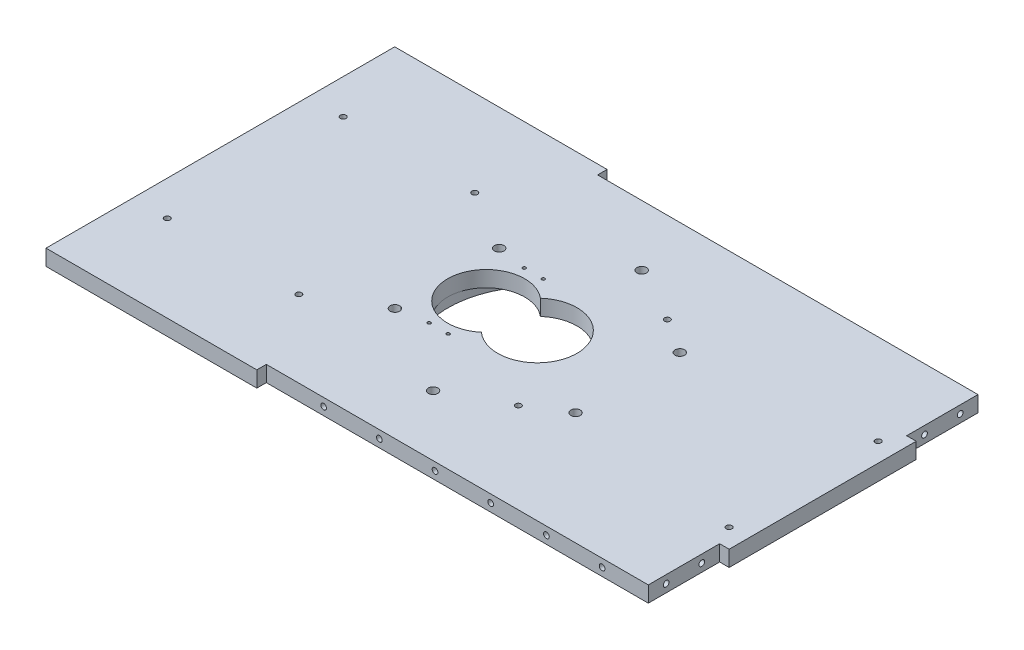
from build123d import *

# Parameters (mm, degrees)
SKETCH_1_W               = 190
SKETCH_1_H               = 110
EXTRUDE_1_DEPTH          = 5
EXTRUDE_2_DEPTH          = 3
CUT_EXTRUDE_1_DEPTH      = 115.236596588
CUT_EXTRUDE_1_DEPTH_BACK = 115.236596588
SKETCH_1_12_R            = 0.9
CUT_EXTRUDE_3_DEPTH      = 115.236596588
CUT_EXTRUDE_START        = 5
SKETCH_1_13_R            = 1.5
CUT_EXTRUDE_4_DEPTH      = 3.5
PATTERN_CIRCULAR_1_COUNT = 6
SKETCH_2_R               = 0.5
CUT_EXTRUDE_5_DEPTH      = 3
CUT_EXTRUDE_6_DEPTH      = 115.236596588
CUT_EXTRUDE_6_DEPTH_BACK = 115.236596588
SKETCH_1_14_R            = 12.5
SKETCH_3_R               = 0.9
CUT_EXTRUDE_7_DEPTH      = 3
SKETCH_4_R               = 0.9
CUT_EXTRUDE_8_DEPTH      = 115.407167608
SKETCH_5_W               = 123
SKETCH_5_H               = 3
SKETCH_5_W_2             = 123.499999633
CUT_EXTRUDE_9_DEPTH      = 115.407167608
SKETCH_6_R               = 0.9
CUT_EXTRUDE_10_DEPTH     = 3
CUT_EXTRUDE_START_2      = -101
SKETCH_6_2_R             = 0.9
CUT_EXTRUDE_11_DEPTH     = 3
SKETCH_7_W               = 22.5
SKETCH_7_H               = 5
CUT_EXTRUDE_12_DEPTH     = 3
SKETCH_8_R               = 0.9
CUT_EXTRUDE_13_DEPTH     = 3


with BuildPart() as part:
    # 草图1 → 凸台-拉伸1 (new body)
    with BuildSketch(Plane(origin=(0, 0, 0), x_dir=(1, 0, 0), z_dir=(0, 1, 0))):
        with Locations((-5, 0)):
            Rectangle(SKETCH_1_W, SKETCH_1_H)
    extrude(amount=EXTRUDE_1_DEPTH)

    # 草图1<10> → 凸台-拉伸2 (add)
    with BuildSketch(Plane(origin=(0, 0, 0), x_dir=(1, 0, 0), z_dir=(0, 1, 0))):
        with BuildLine():
            ThreePointArc((-34.5, 0), (0, 34.5), (34.5, 0))
            Line((34.5, 0), (37.5, 0))
            ThreePointArc((37.5, 0), (0, 37.5), (-37.5, 0))
            Line((-37.5, 0), (-34.5, 0))
        make_face()
        with BuildLine():
            Line((37.5, 0), (34.5, 0))
            ThreePointArc((34.5, 0), (0, -34.5), (-34.5, 0))
            Line((-34.5, 0), (-37.5, 0))
            ThreePointArc((-37.5, 0), (0, -37.5), (37.5, 0))
        make_face()
        with BuildLine():
            ThreePointArc((-28.3, 3.9e-08), (2e-08, 28.3), (28.3, 0))
            Line((28.3, 0), (31.3, 0))
            ThreePointArc((31.3, 0), (0, 31.3), (-31.3, 0))
            Line((-31.3, 0), (-28.3, 0))
        make_face()
        with BuildLine():
            Line((31.3, 0), (28.3, 0))
            ThreePointArc((28.3, 0), (-2e-08, -28.3), (-28.3, 3.9e-08))
            Line((-28.3, 0), (-31.3, 0))
            ThreePointArc((-31.3, 0), (0, -31.3), (31.3, 0))
        make_face()
    extrude(amount=-EXTRUDE_2_DEPTH)

    # 草图1<11> → 切除-拉伸1 (cut, two sides: drawn at the far end of the back side and taken through both)
    with BuildSketch(Plane(origin=(0, 0, 0), x_dir=(1, 0, 0), z_dir=(0, 1, 0)).offset(-CUT_EXTRUDE_1_DEPTH_BACK)):
        with BuildLine():
            ThreePointArc((-8.342105263, -9.309096615), (-12.5, 0), (-8.342105263, 9.309096615))
            ThreePointArc((-8.342105263, 9.309096615), (-28.3, 0), (-8.342105263, -9.309096615))
        make_face()
    extrude(amount=CUT_EXTRUDE_1_DEPTH + CUT_EXTRUDE_1_DEPTH_BACK, mode=Mode.SUBTRACT)

    # 草图1<12> → 切除-拉伸3 (cut, through all)
    with BuildSketch(Plane(origin=(0, 0, 0), x_dir=(1, 0, 0), z_dir=(0, 1, 0))):
        with Locations(Location((0, 32.9, 0), (0, 0, 270))):
            Circle(SKETCH_1_12_R)
    cut_extrude_3 = extrude(amount=CUT_EXTRUDE_3_DEPTH, mode=Mode.SUBTRACT)

    # 草图1<13> → 切除-拉伸4 (cut)
    with BuildSketch(Plane(origin=(0, 0, 0), x_dir=(1, 0, 0), z_dir=(0, 1, 0)).offset(CUT_EXTRUDE_START)):
        with Locations(Location((0, 32.9, 0), (0, 0, 270))):
            Circle(SKETCH_1_13_R)
    cut_extrude_4 = extrude(amount=-CUT_EXTRUDE_4_DEPTH, mode=Mode.SUBTRACT)

    # 阵列(圆周)1: 切除-拉伸3, 切除-拉伸4 ×6 about axis
    pattern_circular_1_axis = Axis((0, 0, 0), (0, 1, 0))
    add([cut_extrude_3.rotate(pattern_circular_1_axis, i * 360 / PATTERN_CIRCULAR_1_COUNT) for i in range(1, PATTERN_CIRCULAR_1_COUNT)], mode=Mode.SUBTRACT)
    add([cut_extrude_4.rotate(pattern_circular_1_axis, i * 360 / PATTERN_CIRCULAR_1_COUNT) for i in range(1, PATTERN_CIRCULAR_1_COUNT)], mode=Mode.SUBTRACT)

    # 草图2 → 切除-拉伸5 (cut)
    with BuildSketch(Plane(origin=(0, 5, 0), x_dir=(1, 0, 0), z_dir=(0, 1, 0))):
        with Locations(Location((-19.15, -15, 0), (0, 0, 270))):
            Circle(SKETCH_2_R)
        with Locations(Location((-13.15, -15, 0), (0, 0, 270))):
            Circle(SKETCH_2_R)
        with Locations(Location((-19.15, 15, 0), (0, 0, 270))):
            Circle(SKETCH_2_R)
        with Locations(Location((-13.15, 15, 0), (0, 0, 270))):
            Circle(SKETCH_2_R)
    extrude(amount=-CUT_EXTRUDE_5_DEPTH, mode=Mode.SUBTRACT)

    # 草图1<14> → 切除-拉伸6 (cut, two sides: drawn at the far end of the back side and taken through both)
    with BuildSketch(Plane(origin=(0, 0, 0), x_dir=(1, 0, 0), z_dir=(0, 1, 0)).offset(-CUT_EXTRUDE_6_DEPTH_BACK)):
        Circle(SKETCH_1_14_R)
    extrude(amount=CUT_EXTRUDE_6_DEPTH + CUT_EXTRUDE_6_DEPTH_BACK, mode=Mode.SUBTRACT)

    # 草图3 → 切除-拉伸7 (cut)
    with BuildSketch(Plane(origin=(0, 5, 0), x_dir=(1, 0, 0), z_dir=(0, 1, 0))):
        with Locations(Location((17.5, 23.5, 0), (0, 0, 270))):
            Circle(SKETCH_3_R)
        with Locations(Location((17.5, -23.5, 0), (0, 0, 270))):
            Circle(SKETCH_3_R)
        with Locations(Location((84, 23.5, 0), (0, 0, 270))):
            Circle(SKETCH_3_R)
        with Locations(Location((84, -23.5, 0), (0, 0, 270))):
            Circle(SKETCH_3_R)
    extrude(amount=-CUT_EXTRUDE_7_DEPTH, mode=Mode.SUBTRACT)

    # 草图4 → 切除-拉伸8 (cut, through all)
    with BuildSketch(Plane(origin=(0, 5, 0), x_dir=(1, 0, 0), z_dir=(0, 1, 0))):
        with Locations(Location((-89.000001478, 27.749997941, 0), (0, 0, 270))):
            Circle(SKETCH_4_R)
        with Locations(Location((-47.500001478, 27.749997941, 0), (0, 0, 270))):
            Circle(SKETCH_4_R)
        with Locations(Location((-89.000001478, -27.750002059, 0), (0, 0, 270))):
            Circle(SKETCH_4_R)
        with Locations(Location((-47.500001478, -27.750002059, 0), (0, 0, 270))):
            Circle(SKETCH_4_R)
    extrude(amount=-CUT_EXTRUDE_8_DEPTH, mode=Mode.SUBTRACT)

    # 草图5 → 切除-拉伸9 (cut, through all)
    with BuildSketch(Plane(origin=(0, 5, 0), x_dir=(1, 0, 0), z_dir=(0, 1, 0))):
        with Locations((28.5, 53.5)):
            Rectangle(SKETCH_5_W, SKETCH_5_H)
        with Locations((28.250000183, -53.5)):
            Rectangle(SKETCH_5_W_2, SKETCH_5_H)
    extrude(amount=-CUT_EXTRUDE_9_DEPTH, mode=Mode.SUBTRACT)

    # 草图6 → 切除-拉伸10 (cut)
    with BuildSketch(Plane(origin=(0, 0, -52), x_dir=(-1, 0, 0), z_dir=(0, 0, -1))):
        with Locations((15.428571429, 2.5)):
            Circle(SKETCH_6_R)
        with Locations((-2.142857143, 2.5)):
            Circle(SKETCH_6_R)
        with Locations((-19.714285714, 2.5)):
            Circle(SKETCH_6_R)
        with Locations((-37.285714286, 2.5)):
            Circle(SKETCH_6_R)
        with Locations((-54.857142857, 2.5)):
            Circle(SKETCH_6_R)
        with Locations((-72.428571429, 2.5)):
            Circle(SKETCH_6_R)
    extrude(amount=-CUT_EXTRUDE_10_DEPTH, mode=Mode.SUBTRACT)

    # 草图6<2> → 切除-拉伸11 (cut)
    with BuildSketch(Plane(origin=(0, 0, -52), x_dir=(-1, 0, 0), z_dir=(0, 0, -1)).offset(CUT_EXTRUDE_START_2)):
        with Locations((15.428571429, 2.5)):
            Circle(SKETCH_6_2_R)
        with Locations((-2.142857143, 2.5)):
            Circle(SKETCH_6_2_R)
        with Locations((-19.714285714, 2.5)):
            Circle(SKETCH_6_2_R)
        with Locations((-37.285714286, 2.5)):
            Circle(SKETCH_6_2_R)
        with Locations((-54.857142857, 2.5)):
            Circle(SKETCH_6_2_R)
        with Locations((-72.428571429, 2.5)):
            Circle(SKETCH_6_2_R)
    extrude(amount=-CUT_EXTRUDE_11_DEPTH, mode=Mode.SUBTRACT)

    # 草图7 → 切除-拉伸12 (cut)
    with BuildSketch(Plane(origin=(90, 0, 0), x_dir=(0, 0, -1), z_dir=(1, 0, 0))):
        with Locations((40.75, 2.5)):
            Rectangle(SKETCH_7_W, SKETCH_7_H)
        with Locations((-40.75, 2.5)):
            Rectangle(SKETCH_7_W, SKETCH_7_H)
    extrude(amount=-CUT_EXTRUDE_12_DEPTH, mode=Mode.SUBTRACT)

    # 草图8 → 切除-拉伸13 (cut)
    with BuildSketch(Plane(origin=(87, 0, 0), x_dir=(0, 0, -1), z_dir=(1, 0, 0))):
        with Locations((35.125, 2.5)):
            Circle(SKETCH_8_R)
        with Locations((46.375, 2.5)):
            Circle(SKETCH_8_R)
        with Locations((-46.375, 2.5)):
            Circle(SKETCH_8_R)
        with Locations((-35.125, 2.5)):
            Circle(SKETCH_8_R)
    extrude(amount=-CUT_EXTRUDE_13_DEPTH, mode=Mode.SUBTRACT)


solid = part.part
